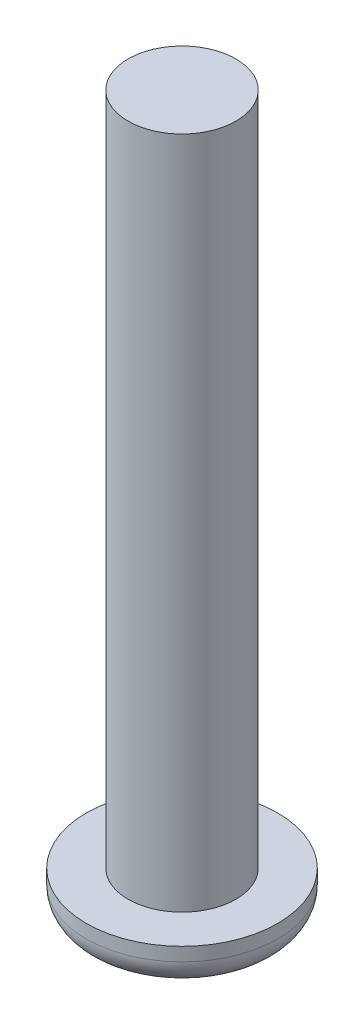
from build123d import *

# Parameters (mm, degrees)
SKETCH1_R           = 4
BOSS_EXTRUDE1_DEPTH = 50
SKETCH2_R           = 7.1
BOSS_EXTRUDE2_DEPTH = 3
FILLET1_R           = 2
CUT_EXTRUDE1_DEPTH  = 1
CUT_EXTRUDE1_DRAFT  = -15


with BuildPart() as part:
    # Sketch1 → Boss-Extrude1 (new body)
    with BuildSketch(Plane(origin=(0, 0, 0), x_dir=(1, 0, 0), z_dir=(0, 1, 0))):
        Circle(SKETCH1_R)
    extrude(amount=BOSS_EXTRUDE1_DEPTH)

    # Sketch2 → Boss-Extrude2 (add)
    with BuildSketch(Plane.XZ):
        Circle(SKETCH2_R)
    extrude(amount=BOSS_EXTRUDE2_DEPTH)

    # Fillet1
    fillet1_edges = [part.edges().sort_by_distance(p)[0] for p in [
        (-7.1, -3, 0),
    ]]
    fillet(fillet1_edges, radius=FILLET1_R)


with BuildPart() as cut_extrude1_tool:
    # Sketch3 → Cut-Extrude1 (with draft: the straight prism first)
    with BuildSketch(Plane.XZ.offset(3)):
        Polygon((0.375, 0.375), (0.375, 1.5), (-0.375, 1.5), (-0.375, 0.375), (-1.5, 0.375), (-1.5, -0.375), (-0.375, -0.375), (-0.375, -1.5), (0.375, -1.5), (0.375, -0.375), (1.5, -0.375), (1.5, 0.375), align=None)
    extrude(amount=-CUT_EXTRUDE1_DEPTH)
    # Cut-Extrude1: the draft: its side faces are tilted about the plane it starts from
    cut_extrude1_sides = [cut_extrude1_tool.faces().sort_by_distance(p)[0] for p in [
        (0.375, -2.5, 0.9375),
        (0, -2.5, 1.5),
        (-0.375, -2.5, 0.9375),
        (-0.9375, -2.5, 0.375),
        (-1.5, -2.5, 0),
        (-0.9375, -2.5, -0.375),
        (-0.375, -2.5, -0.9375),
        (0, -2.5, -1.5),
        (0.375, -2.5, -0.9375),
        (0.9375, -2.5, -0.375),
        (1.5, -2.5, 0),
        (0.9375, -2.5, 0.375),
    ]]
    draft(cut_extrude1_sides, Plane.XZ.offset(3), CUT_EXTRUDE1_DRAFT)


with BuildPart() as part_1:
    add(part.part)

    # Cut-Extrude1: cut by cut_extrude1_tool
    add(cut_extrude1_tool.part, mode=Mode.SUBTRACT)


solid = part_1.part
